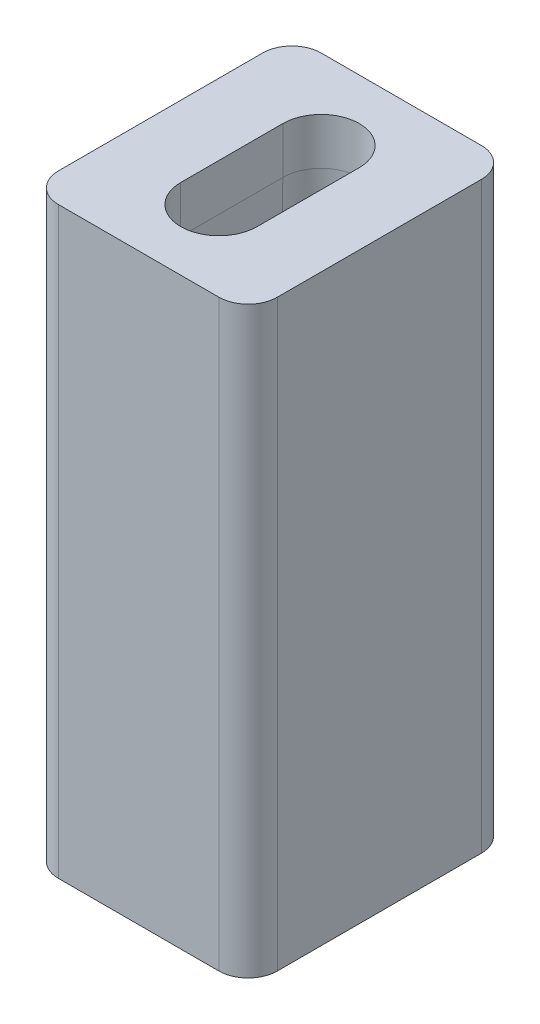
from build123d import *

# Parameters (mm, degrees)
BOSS_EXTRUDE1_DEPTH         = 40
CUT_EXTRUDE2_REACH          = 43.68
M3_TAPPED_HOLE1_D           = 2.5
M3_TAPPED_HOLE1_DEPTH       = 8.5
M3_TAPPED_HOLE1_CSINK_D     = 3.05
M3_TAPPED_HOLE1_CSINK_ANGLE = 90
M3_TAPPED_HOLE1_TIP         = 0.751075774


with BuildPart() as part:
    # Sketch1 → Boss-Extrude1 (new body)
    with BuildSketch(Plane(origin=(0, 0, 0), x_dir=(1, 0, 0), z_dir=(0, 1, 0))):
        with BuildLine():
            Line((-5.5, -9), (5.5, -9))
            ThreePointArc((5.5, -9), (6.914213562, -8.414213562), (7.5, -7))
            Line((7.5, -7), (7.5, 7))
            ThreePointArc((7.5, 7), (6.914213562, 8.414213562), (5.5, 9))
            Line((5.5, 9), (-5.5, 9))
            ThreePointArc((-5.5, 9), (-6.914213562, 8.414213562), (-7.5, 7))
            Line((-7.5, 7), (-7.5, -7))
            ThreePointArc((-7.5, -7), (-6.914213562, -8.414213562), (-5.5, -9))
        make_face()
    extrude(amount=-BOSS_EXTRUDE1_DEPTH)

    # Sketch5 → Cut-Extrude2 (cut, up to next)
    with BuildSketch(Plane(origin=(0, 0, 0), x_dir=(1, 0, 0), z_dir=(0, 1, 0)), mode=Mode.PRIVATE) as cut_extrude2_sk1:
        with BuildLine():
            Line((-2.62, -3.5), (-2.62, 3.5))
            ThreePointArc((-2.62, 3.5), (0, 6.12), (2.62, 3.5))
            Line((2.62, 3.5), (2.62, -3.5))
            ThreePointArc((2.62, -3.5), (0, -6.12), (-2.62, -3.5))
        make_face()
    cut_extrude2_tool1 = extrude(cut_extrude2_sk1.sketch, amount=-CUT_EXTRUDE2_REACH, mode=Mode.PRIVATE) & part.part
    add(cut_extrude2_tool1.solids().sort_by_distance((0, 0, 0))[0], mode=Mode.SUBTRACT)

    # Cut-Sweep1: sweep along a path in Sketch8
    with BuildLine(Plane(origin=(0, 0, 0), x_dir=(1, 0, 0), z_dir=(0, 1, 0))) as cut_sweep1_path:
        Line((-2.62, 3.5), (-2.62, -3.5))
        ThreePointArc((-2.62, -3.5), (0, -6.12), (2.62, -3.5))
        Line((2.62, -3.5), (2.62, 3.5))
        ThreePointArc((2.62, 3.5), (0, 6.12), (-2.62, 3.5))
    # Sketch7 → Cut-Sweep1 (sweep, cut)
    with BuildSketch(Plane.XY):
        Polygon((2.62, -3.2), (3.262346389, -40), (2.62, -40), align=None)
    sweep(path=cut_sweep1_path.line, mode=Mode.SUBTRACT)

    # M3 Tapped Hole1
    with Locations(Plane(origin=(0, -40, 0), x_dir=(-1, 0, 0), z_dir=(0, -1, 0))):
        with Locations((-5, 6.5), (5, -6.5)):
            CounterSinkHole(M3_TAPPED_HOLE1_D / 2, M3_TAPPED_HOLE1_CSINK_D / 2, depth=M3_TAPPED_HOLE1_DEPTH, counter_sink_angle=M3_TAPPED_HOLE1_CSINK_ANGLE)
            with Locations((0, 0, -(M3_TAPPED_HOLE1_DEPTH + M3_TAPPED_HOLE1_TIP / 2))):  # 118° drill point
                Cone(0, M3_TAPPED_HOLE1_D / 2, M3_TAPPED_HOLE1_TIP, mode=Mode.SUBTRACT)


solid = part.part
